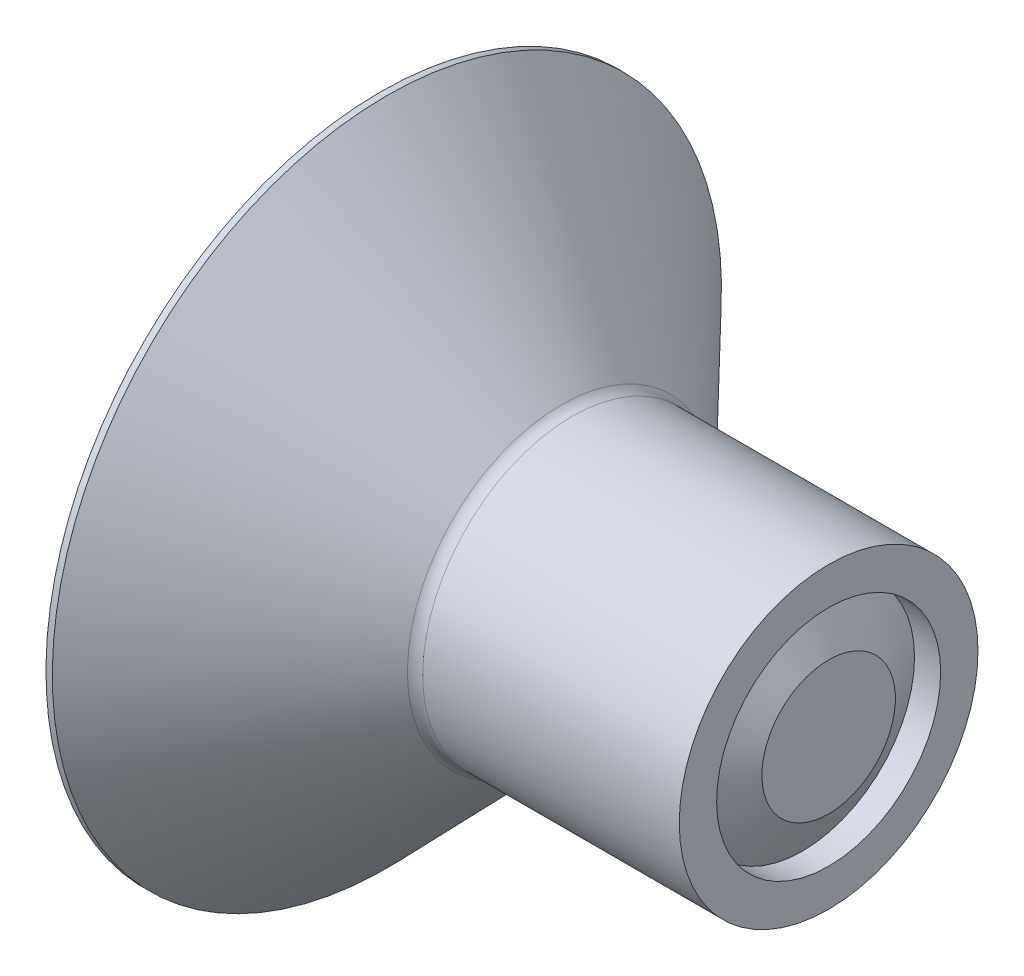
from build123d import *

# Parameters (mm, degrees)
CUT_EXTRUDE_1_DEPTH = 1.96


with BuildPart() as part:
    # 草图1 → 旋转1 (revolve)
    with BuildSketch(Plane.XY):
        with BuildLine():
            Line((0, 2), (-3.435105037, 2))
            ThreePointArc((-3.435105037, 2), (-3.513251262, 2.015899029), (-3.578972997, 2.061068326))
            Line((-3.578972997, 2.061068326), (-5.914908162, 4.48))
            Line((-5.914908162, 4.48), (-6, 4.48))
            Line((-6, 4.48), (-6, 0))
            Line((-6, 0), (0, 0))
            Line((0, 0), (0, 2))
        make_face()
    revolve(axis=Axis((0, 0, 0), (-1, 0, 0)))

    # 草图2 → 切除-拉伸1 (cut)
    with BuildSketch(Plane.ZY.offset(6)):
        Polygon((0, 1.443375673), (-1.25, 0.721687836), (-1.25, -0.721687836), (0, -1.443375673), (1.25, -0.721687836), (1.25, 0.721687836), align=None)
    extrude(amount=-CUT_EXTRUDE_1_DEPTH, mode=Mode.SUBTRACT)

    # 草图7 → 切除-旋转2 (revolve, cut)
    with BuildSketch(Plane.XY):
        Polygon((-6, 1.443375673), (-6, 0), (-5.67, 0), align=None)
    revolve(axis=Axis((-6, 0, 0), (1, 0, 0)), mode=Mode.SUBTRACT)

    # 草图4 → 切除-旋转1 (revolve, cut)
    with BuildSketch(Plane.XY):
        Polygon((-0.35, 1.5), (0, 0.893782217), (0.35, 1.5), align=None)
    revolve(axis=Axis((-0.35, 0, 0), (1, 0, 0)), mode=Mode.SUBTRACT)


solid = part.part
